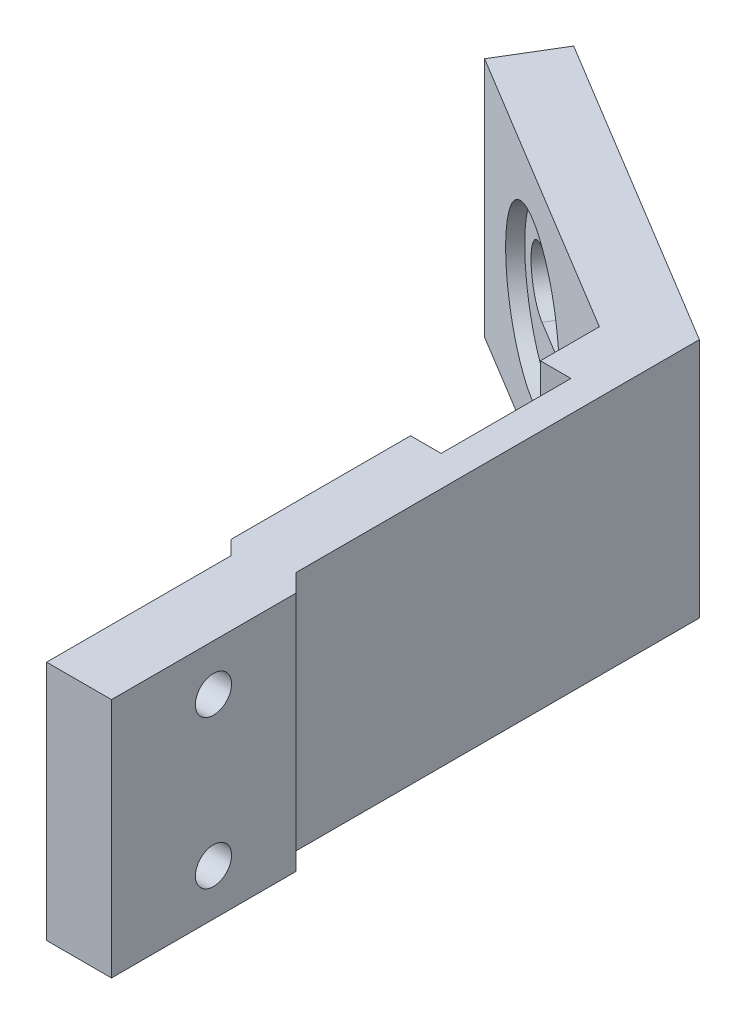
from build123d import *

# Parameters (mm, degrees)
LEG_AND_PAD_DEPTH          = 13
SCREW_HEAD_RELIEF_SKETCH_W = 14
SCREW_HEAD_RELIEF_SKETCH_H = 6
SCREW_HEAD_RELIEF_DEPTH    = 2.35
M6_SLOT_MIDDLE_DEPTH       = 3.5
SCREW_HOLES_SKETCH_R       = 1.95
SCREW_HOLES_DEPTH          = 4.5


with BuildPart() as part:
    # leg and pad sketch → leg and pad (new, symmetric)
    with BuildSketch(Plane(origin=(0, -20.7, 0), x_dir=(1, 0, 0), z_dir=(0, 1, 0))):
        Polygon((0.4, 29.7585923), (0.4, -9.98), (1.92, -11.5), (1.92, -31.37), (8.92, -31.37), (8.92, -11.5), (7, -9.58), (7, 33.951399666), (-27.204821487, 54.594667874), (-30.821788068, 48.601542416), align=None)
    extrude(amount=LEG_AND_PAD_DEPTH, both=True)

    # screw head relief sketch → screw head relief (cut, symmetric)
    with BuildSketch(Plane(origin=(1.35, 0, 0), x_dir=(0, 0, -1), z_dir=(1, 0, 0))):
        with Locations((16.4, -9.7)):
            Rectangle(SCREW_HEAD_RELIEF_SKETCH_W, SCREW_HEAD_RELIEF_SKETCH_H)
    extrude(amount=SCREW_HEAD_RELIEF_DEPTH, both=True, mode=Mode.SUBTRACT)

    # insert flange relief sketch → insert flange relief (revolve, cut)
    with BuildSketch(Plane(origin=(0, -20.7, 0), x_dir=(1, 0, 0), z_dir=(0, 1, 0))):
        Polygon((-18.324853729, 39.891397061), (-17.03307995, 42.03179901), (-9.755713323, 37.639768162), (-11.047487102, 35.499366213), align=None)
    revolve(axis=Axis((-18.324853729, -20.7, -39.891397061), (0.5167095115681243, 0, -0.8561607796757748)), mode=Mode.SUBTRACT)

    # M6 slot end 1 sketch → M6 slot end 1 (revolve, cut)
    with BuildSketch(Plane(origin=(0, -20.7, 0), x_dir=(1, 0, 0), z_dir=(0, 1, 0))):
        Polygon((-20.893336068, 41.441525596), (-16.242950464, 49.146972613), (-13.246387735, 47.338489322), (-17.896773339, 39.633042305), align=None)
    revolve(axis=Axis((-20.893336068, -20.7, -41.441525596), (0.5167095115681233, 0, -0.8561607796757753)), mode=Mode.SUBTRACT)

    # M6 slot end 2 sketch → M6 slot end 2 (revolve, cut)
    with BuildSketch(Plane(origin=(0, -20.7, 0), x_dir=(1, 0, 0), z_dir=(0, 1, 0))):
        Polygon((-15.75637139, 38.341268526), (-11.105985786, 46.046715543), (-8.109423057, 44.238232253), (-12.759808661, 36.532785236), align=None)
    revolve(axis=Axis((-15.75637139, -20.7, -38.341268526), (0.5167095115681234, 0, -0.8561607796757752)), mode=Mode.SUBTRACT)

    # M6 slot middle sketch → M6 slot middle (cut, symmetric)
    with BuildSketch(Plane(origin=(0, -20.7, 0), x_dir=(1, 0, 0), z_dir=(0, 1, 0))):
        Polygon((-15.75637139, 38.341268526), (-20.893336068, 41.441525596), (-16.242950464, 49.146972613), (-11.105985786, 46.046715543), align=None)
    extrude(amount=M6_SLOT_MIDDLE_DEPTH, both=True, mode=Mode.SUBTRACT)

    # screw holes sketch → screw holes (cut, symmetric)
    with BuildSketch(Plane(origin=(5.42, 0, 0), x_dir=(0, 0, -1), z_dir=(1, 0, 0))):
        with Locations((-20.375, -28.7)):
            Circle(SCREW_HOLES_SKETCH_R)
        with Locations((-20.375, -12.7)):
            Circle(SCREW_HOLES_SKETCH_R)
    extrude(amount=SCREW_HOLES_DEPTH, both=True, mode=Mode.SUBTRACT)


solid = part.part
